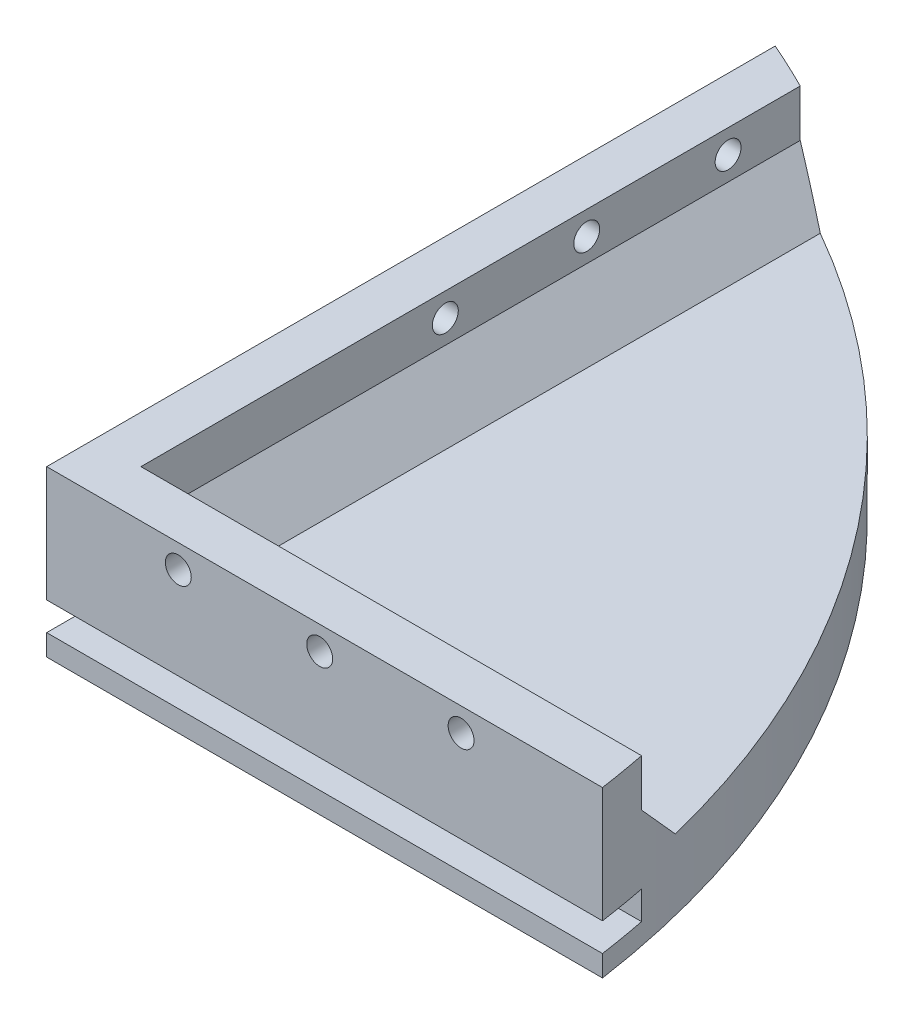
from build123d import *

# Parameters (mm, degrees)
SKETCH1_R                = 200
BOSS_EXTRUDE1_DEPTH      = 15
BOSS_EXTRUDE2_DEPTH      = 200
CUT_EXTRUDE1_DEPTH       = 286.087705803
CUT_EXTRUDE1_DEPTH_BACK  = 286.087705803
SKETCH3_R                = 85
CUT_EXTRUDE2_DEPTH       = 451.079120005
CUT_EXTRUDE2_DEPTH_BACK  = 451.079120005
SKETCH4_R                = 11
CUT_EXTRUDE3_DEPTH       = 451.079120105
CUT_EXTRUDE3_DEPTH_BACK  = 110
CUT_EXTRUDE4_DEPTH       = 110
BOSS_EXTRUDE3_DEPTH      = 200
CUT_EXTRUDE5_DEPTH       = 286.087705815
CUT_EXTRUDE5_DEPTH_BACK  = 286.087705815
SKETCH7_OUTSIDE_W        = 515.59
SKETCH7_OUTSIDE_H        = 515.59
SKETCH7_OUTSIDE_R        = 200
SKETCH9_R                = 4
BOSS_EXTRUDE4_DEPTH      = 220
CUT_EXTRUDE6_DEPTH       = 190
SKETCH11_R               = 3
CUT_EXTRUDE7_DEPTH       = 486.974499745
CUT_EXTRUDE8_DEPTH       = 300.457843596
CUT_EXTRUDE8_DEPTH_BACK  = 300.457843596
SKETCH12_OUTSIDE_W       = 561.36
SKETCH12_OUTSIDE_H       = 521.36
BOSS_EXTRUDE5_DEPTH      = 160
BOSS_EXTRUDE6_DEPTH      = 160
CUT_EXTRUDE9_START       = 15
CUT_EXTRUDE9_DEPTH       = 20
CUT_EXTRUDE10_DEPTH      = 254.564671702
CUT_EXTRUDE10_DEPTH_BACK = 254.564671702
SKETCH17_W               = 10
SKETCH17_H               = 6
CUT_EXTRUDE11_DEPTH      = 221.752620232
CUT_EXTRUDE11_DEPTH_BACK = 221.752620232
SKETCH18_W               = 10
SKETCH18_H               = 6
SKETCH19_R               = 2.75
CUT_EXTRUDE12_DEPTH      = 10
SKETCH20_R               = 2.75
CUT_EXTRUDE13_DEPTH      = 10


# Read off the part's stored shape, not the designer's step: Cut-Extrude9
with BuildPart() as part:
    # Sketch1 → Boss-Extrude1 (new body)
    with BuildSketch(Plane(origin=(0, 0, 0), x_dir=(1, 0, 0), z_dir=(0, 1, 0))):
        with Locations(Location((0, 0, 0), (0, 0, 270))):
            Circle(SKETCH1_R)
    extrude(amount=BOSS_EXTRUDE1_DEPTH)

    # Sketch2 → Boss-Extrude2 (add, symmetric)
    with BuildSketch(Plane.XY):
        Polygon((-25, 50.707142143), (25, 50.707142143), (60, 15), (-60, 15), align=None)
    extrude(amount=BOSS_EXTRUDE2_DEPTH, both=True)

    # Sketch3 → Cut-Extrude1 (cut, two sides: drawn at the far end of the back side and taken through both)
    with BuildSketch(Plane(origin=(0, 15, 0), x_dir=(1, 0, 0), z_dir=(0, 1, 0)).offset(-CUT_EXTRUDE1_DEPTH_BACK)):
        with Locations(Location((0, 0, 0), (0, 0, 270))):
            Circle(SKETCH3_R)
    extrude(amount=CUT_EXTRUDE1_DEPTH + CUT_EXTRUDE1_DEPTH_BACK, mode=Mode.SUBTRACT)

    # Sketch4 → Cut-Extrude2 (cut, two sides: drawn at the far end of the back side and taken through both)
    with BuildSketch(Plane(origin=(0, 0, -200), x_dir=(-1, 0, 0), z_dir=(0, 0, -1)).offset(-CUT_EXTRUDE2_DEPTH_BACK)):
        with Locations((0, 29)):
            Circle(SKETCH4_R)
    extrude(amount=CUT_EXTRUDE2_DEPTH + CUT_EXTRUDE2_DEPTH_BACK, mode=Mode.SUBTRACT)

    # Sketch5 → Cut-Extrude3 (cut, two sides: drawn at the far end of the back side and taken through both)
    with BuildSketch(Plane.XY.offset(200).offset(-CUT_EXTRUDE3_DEPTH_BACK)):
        Polygon((-25, 50.707142143), (25, 50.707142143), (50.198039412, 25), (25, 25), (25, 15), (-25, 15), (-25, 25), (-50.198039412, 25), align=None)
    extrude(amount=CUT_EXTRUDE3_DEPTH + CUT_EXTRUDE3_DEPTH_BACK, mode=Mode.SUBTRACT)

    # Sketch6 → Cut-Extrude4 (cut)
    with BuildSketch(Plane(origin=(0, 0, -200), x_dir=(-1, 0, 0), z_dir=(0, 0, -1))):
        Polygon((-25, 50.707142143), (25, 50.707142143), (50.198039412, 25), (25, 25), (25, 15), (-25, 15), (-25, 25), (-50.198039412, 25), align=None)
    extrude(amount=-CUT_EXTRUDE4_DEPTH, mode=Mode.SUBTRACT)

    # Sketch8 → Boss-Extrude3 (add, symmetric)
    with BuildSketch(Plane(origin=(0, 0, 0), x_dir=(0, 0, -1), z_dir=(1, 0, 0))):
        Polygon((0, 15), (-20, 15), (-10, 35.712315177), (10, 35.712315177), (20, 15), align=None)
    extrude(amount=BOSS_EXTRUDE3_DEPTH, both=True)

    # Sketch7 outside → Cut-Extrude5 (cut, two sides: drawn at the far end of the back side and taken through both)
    with BuildSketch(Plane(origin=(0, 15, 0), x_dir=(1, 0, 0), z_dir=(0, 1, 0)).offset(-CUT_EXTRUDE5_DEPTH_BACK)):
        Rectangle(SKETCH7_OUTSIDE_W, SKETCH7_OUTSIDE_H)
        with Locations(Location((0, 0, 0), (0, 0, 97.180755781))):
            Circle(SKETCH7_OUTSIDE_R, mode=Mode.SUBTRACT)
    extrude(amount=CUT_EXTRUDE5_DEPTH + CUT_EXTRUDE5_DEPTH_BACK, mode=Mode.SUBTRACT)

    # Sketch9 → Boss-Extrude4 (add, symmetric)
    with BuildSketch(Plane(origin=(0, 0, 0), x_dir=(0, 0, -1), z_dir=(1, 0, 0))):
        with Locations(Location((0, 29, 0), (0, 0, 180))):
            Circle(SKETCH9_R)
    extrude(amount=BOSS_EXTRUDE4_DEPTH, both=True)

    # Sketch10 → Cut-Extrude6 (cut, symmetric)
    with BuildSketch(Plane(origin=(0, 0, 0), x_dir=(0, 0, -1), z_dir=(1, 0, 0))):
        Polygon((-20, 15), (20, 15), (10, 35.712315177), (-10, 35.712315177), align=None)
    extrude(amount=CUT_EXTRUDE6_DEPTH, both=True, mode=Mode.SUBTRACT)

    # Sketch11 → Cut-Extrude7 (cut, through all)
    with BuildSketch(Plane.ZY.offset(220)):
        with Locations((0, 29)):
            Circle(SKETCH11_R)
    extrude(amount=-CUT_EXTRUDE7_DEPTH, mode=Mode.SUBTRACT)

    # Sketch12 outside → Cut-Extrude8 (cut, two sides: drawn at the far end of the back side and taken through both)
    with BuildSketch(Plane(origin=(0, 15, 0), x_dir=(1, 0, 0), z_dir=(0, 1, 0)).offset(-CUT_EXTRUDE8_DEPTH_BACK)):
        Rectangle(SKETCH12_OUTSIDE_W, SKETCH12_OUTSIDE_H)
        Polygon((80, 28.722813233), (80, 205.18025718), (287.401401401, 28.722813233), align=None, mode=Mode.SUBTRACT)
    extrude(amount=CUT_EXTRUDE8_DEPTH + CUT_EXTRUDE8_DEPTH_BACK, mode=Mode.SUBTRACT)

    # Sketch13 → Boss-Extrude5 (add)
    with BuildSketch(Plane.XY.offset(-28.722813233)):
        Polygon((80, 15), (80, 35), (90, 35), (90, 25), (99.19, 15), align=None)
    extrude(amount=-BOSS_EXTRUDE5_DEPTH)

    # Sketch15 → Boss-Extrude6 (add)
    with BuildSketch(Plane(origin=(90, 0, 0), x_dir=(0, 0, -1), z_dir=(1, 0, 0))):
        Polygon((28.722813233, 15), (28.722813233, 35), (38.722813233, 35), (38.722813233, 25), (47.915201388, 15), align=None)
    extrude(amount=BOSS_EXTRUDE6_DEPTH)

    # Cut-Extrude9 outline → Cut-Extrude9 (cut)
    with BuildSketch(Plane(origin=(0, 0, 0), x_dir=(1, 0, 0), z_dir=(0, 1, 0)).offset(CUT_EXTRUDE9_START)):
        with BuildLine():
            Line((78, 184.175899359), (80, 183.303027798))
            ThreePointArc((80, 183.303027798), (159.011260133, 121.307127371), (197.926754129, 28.722813233))
            Line((197.926754129, 28.722813233), (250, 28.722813233))
            Line((250, 28.722813233), (250, 188.722813233))
            Line((250, 188.722813233), (78, 188.722813233))
            Line((78, 188.722813233), (78, 184.175899359))
        make_face()
    extrude(amount=CUT_EXTRUDE9_DEPTH, mode=Mode.SUBTRACT)

    # Sketch17 → Cut-Extrude10 (cut, two sides: drawn at the far end of the back side and taken through both)
    with BuildSketch(Plane.XY.offset(-28.722813233).offset(-CUT_EXTRUDE10_DEPTH_BACK)):
        with Locations((85, 7.5)):
            Rectangle(SKETCH17_W, SKETCH17_H)
    extrude(amount=CUT_EXTRUDE10_DEPTH + CUT_EXTRUDE10_DEPTH_BACK, mode=Mode.SUBTRACT)

    # Sketch18 → Cut-Extrude11 (cut, two sides: drawn at the far end of the back side and taken through both)
    with BuildSketch(Plane.ZY.offset(-80).offset(-CUT_EXTRUDE11_DEPTH_BACK)):
        with Locations((-33.722813233, 7.5)):
            Rectangle(SKETCH18_W, SKETCH18_H)
    extrude(amount=CUT_EXTRUDE11_DEPTH + CUT_EXTRUDE11_DEPTH_BACK, mode=Mode.SUBTRACT)

    # Sketch19 → Cut-Extrude12 (cut)
    with BuildSketch(Plane.XY.offset(-28.722813233)):
        with Locations((107.926754129, 30)):
            Circle(SKETCH19_R)
        with Locations((167.926754129, 30)):
            Circle(SKETCH19_R)
        with Locations((137.926754129, 30)):
            Circle(SKETCH19_R)
    extrude(amount=-CUT_EXTRUDE12_DEPTH, mode=Mode.SUBTRACT)

    # Sketch20 → Cut-Extrude13 (cut)
    with BuildSketch(Plane.ZY.offset(-80)):
        with Locations((-163.303027798, 30)):
            Circle(SKETCH20_R)
        with Locations((-133.303027798, 30)):
            Circle(SKETCH20_R)
        with Locations((-103.303027798, 30)):
            Circle(SKETCH20_R)
    extrude(amount=-CUT_EXTRUDE13_DEPTH, mode=Mode.SUBTRACT)


solid = part.part
